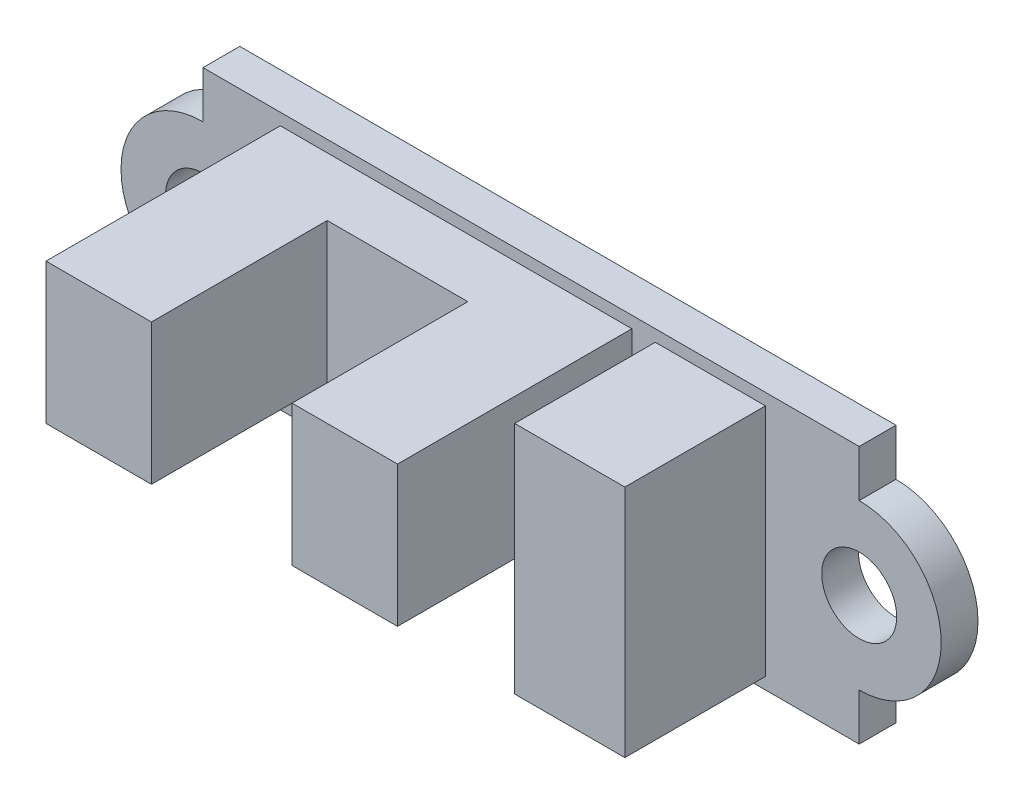
from build123d import *

# Parameters (mm, degrees)
SKETCH1_R                  = 1.6
PCB_DEPTH                  = 1.57
SKETCH2_W                  = 6
SKETCH2_H                  = 6
OPTICAL_SENSOR_BASE_DEPTH  = 2.5
SKETCH2_3_W                = 4.5
SKETCH2_3_H                = 6
OPTICAL_SENSOR_SIDES_DEPTH = 10
SKETCH2_4_W                = 4.7
SKETCH2_4_H                = 10
CONNECTOR_DEPTH            = 6


with BuildPart() as part:
    # Sketch1 → PCB (new body)
    with BuildSketch(Plane.XY):
        with BuildLine():
            Line((-14, 3.5), (-14, 5.5))
            Line((-14, 5.5), (14, 5.5))
            Line((14, 5.5), (14, 3.5))
            ThreePointArc((14, 3.5), (17.5, 0), (14, -3.5))
            Line((14, -3.5), (14, -5.5))
            Line((14, -5.5), (-14, -5.5))
            Line((-14, -5.5), (-14, -3.5))
            ThreePointArc((-14, -3.5), (-17.5, 0), (-14, 3.5))
        make_face()
        with Locations((-14, 0)):
            Circle(SKETCH1_R, mode=Mode.SUBTRACT)
        with Locations((14, 0)):
            Circle(SKETCH1_R, mode=Mode.SUBTRACT)
    extrude(amount=-PCB_DEPTH)

    # Sketch2<4> → Connector (add)
    with BuildSketch(Plane.XY):
        with Locations((7.65, 0)):
            Rectangle(SKETCH2_4_W, SKETCH2_4_H)
    extrude(amount=CONNECTOR_DEPTH)


with BuildPart() as body_2:
    # Sketch2 → Optical Sensor Base (new body)
    with BuildSketch(Plane.XY):
        with Locations((-3.2, 2)):
            Rectangle(SKETCH2_W, SKETCH2_H)
    extrude(amount=OPTICAL_SENSOR_BASE_DEPTH)

    # Sketch2<3> → Optical Sensor Sides (add)
    with BuildSketch(Plane.XY):
        with Locations((-8.45, 2)):
            Rectangle(SKETCH2_3_W, SKETCH2_3_H)
        with Locations((2.05, 2)):
            Rectangle(SKETCH2_3_W, SKETCH2_3_H)
    extrude(amount=OPTICAL_SENSOR_SIDES_DEPTH)


solid = Compound([part.part, body_2.part])
